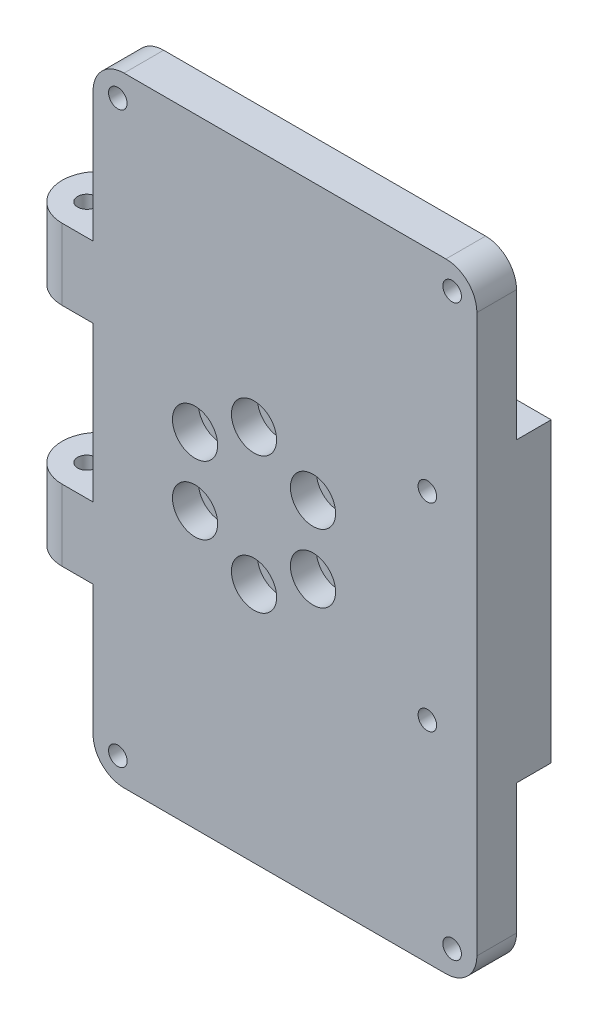
from build123d import *

# Parameters (mm, degrees)
SKETCH_1_W           = 72
SKETCH_1_H           = 100
EXTRUDE_1_DEPTH      = 12
SKETCH_2_R           = 1.5
CUT_EXTRUDE_1_DEPTH  = 13
SKETCH_4_R           = 1.5
CUT_EXTRUDE_3_DEPTH  = 15
SKETCH_5_R           = 14.5
EXTRUDE_2_DEPTH      = 3.8
SKETCH_6_R           = 1.9
CUT_EXTRUDE_6_DEPTH  = 20
SKETCH_7_R           = 3.65
CUT_EXTRUDE_7_DEPTH  = 4.2
SKETCH_8_R           = 2.9
CUT_EXTRUDE_8_DEPTH  = 3.2
SKETCH_9_W           = 72
SKETCH_9_H           = 26
CUT_EXTRUDE_9_DEPTH  = 5.6
FILLET_1_R           = 5
SKETCH_10_W          = 10
SKETCH_10_H          = 100
CUT_EXTRUDE_10_DEPTH = 20
SKETCH_11_W          = 12
SKETCH_11_H          = 48
EXTRUDE_3_DEPTH      = 11
SKETCH_12_R          = 1.5
CUT_EXTRUDE_11_DEPTH = 50
SKETCH_14_W          = 12
SKETCH_14_H          = 25
CUT_EXTRUDE_12_DEPTH = 11
FILLET_2_R           = 6
FILLET_3_R           = 5


with BuildPart() as part:
    # 草图1 → 凸台-拉伸1 (new body)
    with BuildSketch(Plane.XY):
        Rectangle(SKETCH_1_W, SKETCH_1_H)
    extrude(amount=EXTRUDE_1_DEPTH)

    # 草图2 → 切除-拉伸1 (cut)
    with BuildSketch(Plane(origin=(0, 0, 0), x_dir=(-1, 0, 0), z_dir=(0, 0, -1))):
        with Locations((-28, 16)):
            Circle(SKETCH_2_R)
        with Locations((-28, -16)):
            Circle(SKETCH_2_R)
    extrude(amount=-CUT_EXTRUDE_1_DEPTH, mode=Mode.SUBTRACT)

    # 草图4 → 切除-拉伸3 (cut)
    with BuildSketch(Plane(origin=(0, 0, 0), x_dir=(-1, 0, 0), z_dir=(0, 0, -1))):
        with Locations((-32, 46)):
            Circle(SKETCH_4_R)
        with Locations((22, 46)):
            Circle(SKETCH_4_R)
        with Locations((-32, -46)):
            Circle(SKETCH_4_R)
        with Locations((22, -46)):
            Circle(SKETCH_4_R)
    extrude(amount=-CUT_EXTRUDE_3_DEPTH, mode=Mode.SUBTRACT)

    # 草图5 → 凸台-拉伸2 (add)
    with BuildSketch(Plane(origin=(0, 0, 0), x_dir=(-1, 0, 0), z_dir=(0, 0, -1))):
        with Locations(Location((0, 0, 0), (0, 0, 180))):
            Circle(SKETCH_5_R)
    extrude(amount=EXTRUDE_2_DEPTH)

    # 草图6 → 切除-拉伸6 (cut)
    with BuildSketch(Plane(origin=(0, 0, -3.8), x_dir=(-1, 0, 0), z_dir=(0, 0, -1))):
        with Locations((0, 11)):
            Circle(SKETCH_6_R)
        with Locations((9.526279442, 5.5)):
            Circle(SKETCH_6_R)
        with Locations((9.526279442, -5.5)):
            Circle(SKETCH_6_R)
        with Locations((0, -11)):
            Circle(SKETCH_6_R)
        with Locations((-9.526279442, -5.5)):
            Circle(SKETCH_6_R)
        with Locations((-9.526279442, 5.5)):
            Circle(SKETCH_6_R)
    extrude(amount=-CUT_EXTRUDE_6_DEPTH, mode=Mode.SUBTRACT)

    # 草图7 → 切除-拉伸7 (cut)
    with BuildSketch(Plane.XY.offset(12)):
        with Locations((0, 11)):
            Circle(SKETCH_7_R)
        with Locations((9.526279442, 5.5)):
            Circle(SKETCH_7_R)
        with Locations((9.526279442, -5.5)):
            Circle(SKETCH_7_R)
        with Locations((0, -11)):
            Circle(SKETCH_7_R)
        with Locations((-9.526279442, -5.5)):
            Circle(SKETCH_7_R)
        with Locations((-9.526279442, 5.5)):
            Circle(SKETCH_7_R)
    extrude(amount=-CUT_EXTRUDE_7_DEPTH, mode=Mode.SUBTRACT)

    # 草图8 → 切除-拉伸8 (cut)
    with BuildSketch(Plane(origin=(0, 0, 0), x_dir=(-1, 0, 0), z_dir=(0, 0, -1))):
        with Locations((-28, 16)):
            Circle(SKETCH_8_R)
        with Locations((-28, -16)):
            Circle(SKETCH_8_R)
    extrude(amount=-CUT_EXTRUDE_8_DEPTH, mode=Mode.SUBTRACT)

    # 草图9 → 切除-拉伸9 (cut)
    with BuildSketch(Plane(origin=(0, 0, 0), x_dir=(-1, 0, 0), z_dir=(0, 0, -1))):
        with Locations((0, 37)):
            Rectangle(SKETCH_9_W, SKETCH_9_H)
        with Locations((0, -37)):
            Rectangle(SKETCH_9_W, SKETCH_9_H)
    extrude(amount=-CUT_EXTRUDE_9_DEPTH, mode=Mode.SUBTRACT)

    # 圆角1
    fillet_1_edges = [part.edges().sort_by_distance(p)[0] for p in [
        (36, -50, 8.8),
        (-36, -50, 8.8),
        (-36, 50, 8.8),
        (36, 50, 8.8),
    ]]
    fillet(fillet_1_edges, radius=FILLET_1_R)

    # 草图10 → 切除-拉伸10 (cut)
    with BuildSketch(Plane(origin=(0, 0, 0), x_dir=(-1, 0, 0), z_dir=(0, 0, -1))):
        with Locations((31, 0)):
            Rectangle(SKETCH_10_W, SKETCH_10_H)
    extrude(amount=-CUT_EXTRUDE_10_DEPTH, mode=Mode.SUBTRACT)

    # 草图11 → 凸台-拉伸3 (add)
    with BuildSketch(Plane.ZY.offset(26)):
        with Locations((6, 0)):
            Rectangle(SKETCH_11_W, SKETCH_11_H)
    extrude(amount=EXTRUDE_3_DEPTH)

    # 草图12 → 切除-拉伸11 (cut)
    with BuildSketch(Plane.XZ.offset(24)):
        with Locations(Location((-32, 7, 0), (0, 0, 270))):
            Circle(SKETCH_12_R)
    extrude(amount=-CUT_EXTRUDE_11_DEPTH, mode=Mode.SUBTRACT)

    # 草图14 → 切除-拉伸12 (cut)
    with BuildSketch(Plane.ZY.offset(37)):
        with Locations((6, 0)):
            Rectangle(SKETCH_14_W, SKETCH_14_H)
    extrude(amount=-CUT_EXTRUDE_12_DEPTH, mode=Mode.SUBTRACT)

    # 圆角2
    fillet_2_edges = [part.edges().sort_by_distance(p)[0] for p in [
        (-37, 18.25, 0),
        (-37, 18.25, 12),
        (-37, -18.25, 0),
        (-37, -18.25, 12),
    ]]
    fillet(fillet_2_edges, radius=FILLET_2_R - 0.0001)  # a hair under: the kernel refuses the full size

    # 圆角3
    fillet_3_edges = [part.edges().sort_by_distance(p)[0] for p in [
        (-26, -50, 8.8),
        (-26, 50, 8.8),
    ]]
    fillet(fillet_3_edges, radius=FILLET_3_R)


solid = part.part
